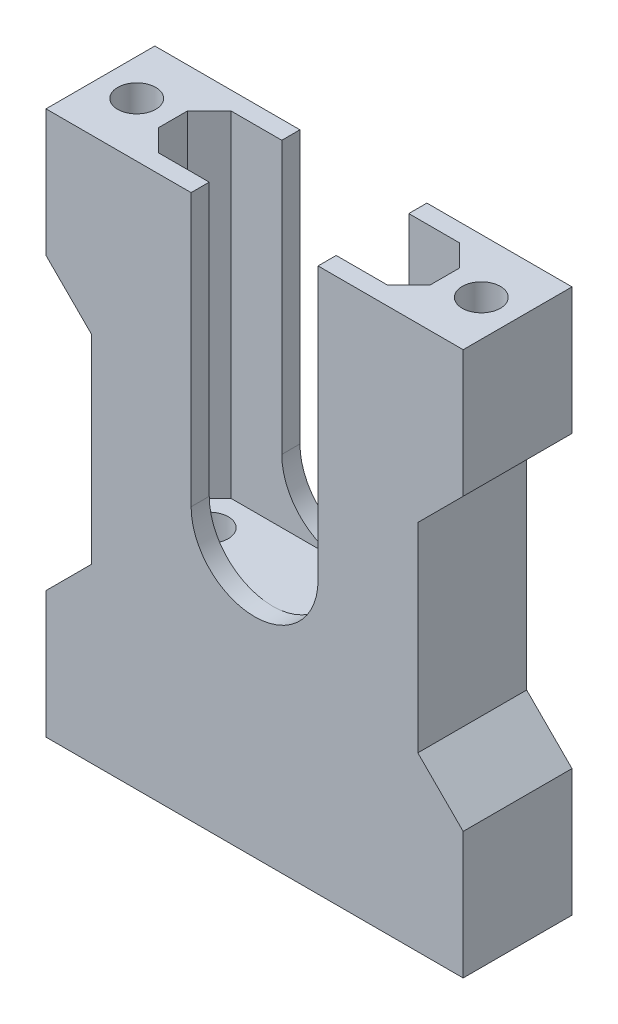
from build123d import *

# Parameters (mm, degrees)
DODANIE_WYCI_GNI_CIE1_DEPTH = 12
SZKIC2_R                    = 2.1
WYTNIJ_WYCI_GNI_CIE1_DEPTH  = 10
WYTNIJ_WYCI_GNI_CIE2_DEPTH  = 37
WYTNIJ_WYCI_GNI_CIE3_REACH  = 47.188
SZKIC4_R                    = 2.1
WYTNIJ_WYCI_GNI_CIE4_DEPTH  = 6


with BuildPart() as part:
    # Szkic1 → Dodanie-wyciągnięcie1 (new body)
    with BuildSketch(Plane.XY):
        with BuildLine():
            Line((-23, 0), (23, 0))
            Line((23, 0), (23, 14))
            Line((23, 14), (18, 19))
            Line((18, 19), (18, 41))
            Line((18, 41), (23, 46))
            Line((23, 46), (23, 60))
            Line((23, 60), (7, 60))
            Line((7, 60), (7, 30))
            ThreePointArc((7, 30), (0, 23), (-7, 30))
            Line((-7, 30), (-7, 60))
            Line((-7, 60), (-23, 60))
            Line((-23, 60), (-23, 46))
            Line((-23, 46), (-18, 41))
            Line((-18, 41), (-18, 19))
            Line((-18, 19), (-23, 14))
            Line((-23, 14), (-23, 0))
        make_face()
    extrude(amount=DODANIE_WYCI_GNI_CIE1_DEPTH)

    # Szkic2 → Wytnij-wyciągnięcie1 (cut)
    with BuildSketch(Plane(origin=(0, 60, 0), x_dir=(1, 0, 0), z_dir=(0, 1, 0))):
        with Locations((-19, -6)):
            Circle(SZKIC2_R)
        with Locations((19, -6)):
            Circle(SZKIC2_R)
    wytnij_wyci_gni_cie1 = extrude(amount=-WYTNIJ_WYCI_GNI_CIE1_DEPTH, mode=Mode.SUBTRACT)

    # Lustro1: Wytnij-wyciągnięcie1 across plane
    add(wytnij_wyci_gni_cie1.mirror(Plane(origin=(0, 30, 0), x_dir=(0, 0, 1), z_dir=(0, -1, 0))), mode=Mode.SUBTRACT)

    # Szkic3 → Wytnij-wyciągnięcie2 (cut)
    with BuildSketch(Plane(origin=(0, 60, 0), x_dir=(-1, 0, 0), z_dir=(0, -1, 0))):
        Polygon((12.6, -2), (-12.6, -2), (-15, -4.4), (-15, -7.6), (-12.6, -10), (12.6, -10), (15, -7.6), (15, -4.4), align=None)
    extrude(amount=WYTNIJ_WYCI_GNI_CIE2_DEPTH, mode=Mode.SUBTRACT)

    # Szkic4 → Wytnij-wyciągnięcie3 (cut, up to next)
    with BuildSketch(Plane(origin=(0, 23, 0), x_dir=(1, 0, 0), z_dir=(0, 1, 0)), mode=Mode.PRIVATE) as wytnij_wyci_gni_cie3_sk1:
        with Locations((11, -6)):
            Circle(SZKIC4_R)
    wytnij_wyci_gni_cie3_tool1 = extrude(wytnij_wyci_gni_cie3_sk1.sketch, amount=-WYTNIJ_WYCI_GNI_CIE3_REACH, mode=Mode.PRIVATE) & part.part
    # Szkic4 → Wytnij-wyciągnięcie3 (cut, up to next)
    with BuildSketch(Plane(origin=(0, 23, 0), x_dir=(1, 0, 0), z_dir=(0, 1, 0)), mode=Mode.PRIVATE) as wytnij_wyci_gni_cie3_sk2:
        with Locations((-11, -6)):
            Circle(SZKIC4_R)
    wytnij_wyci_gni_cie3_tool2 = extrude(wytnij_wyci_gni_cie3_sk2.sketch, amount=-WYTNIJ_WYCI_GNI_CIE3_REACH, mode=Mode.PRIVATE) & part.part
    add(wytnij_wyci_gni_cie3_tool1.solids().sort_by_distance((11, 23, 6))[0], mode=Mode.SUBTRACT)
    add(wytnij_wyci_gni_cie3_tool2.solids().sort_by_distance((-11, 23, 6))[0], mode=Mode.SUBTRACT)

    # Szkic5 → Wytnij-wyciągnięcie4 (cut)
    with BuildSketch(Plane.XZ):
        Polygon((11, 1.727608008), (14.7, 3.863804004), (14.7, 8.136195996), (11, 10.272391992), (7.3, 8.136195996), (7.3, 3.863804004), align=None)
        Polygon((-7.3, 3.863804004), (-11, 1.727608008), (-14.7, 3.863804004), (-14.7, 8.136195996), (-11, 10.272391992), (-7.3, 8.136195996), align=None)
    extrude(amount=-WYTNIJ_WYCI_GNI_CIE4_DEPTH, mode=Mode.SUBTRACT)


solid = part.part
